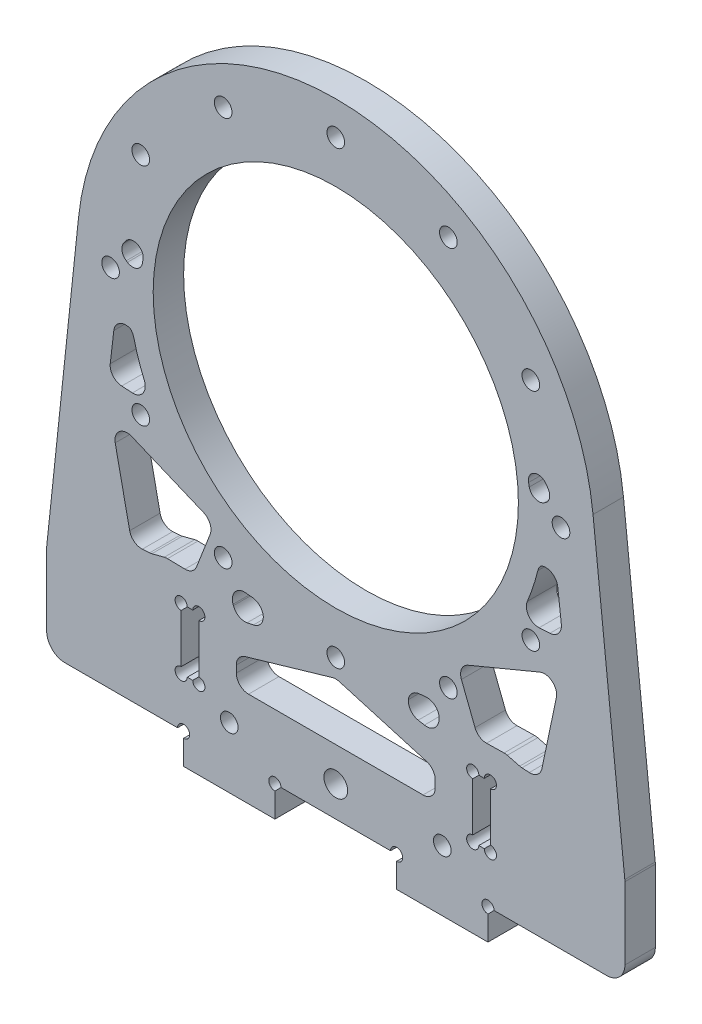
from build123d import *

# Parameters (mm, degrees)
SKETCH_1_R          = 30
SKETCH_1_R_2        = 1.45
EXTRUDE_1_DEPTH     = 5
SKETCH_2_W          = 15
SKETCH_2_H          = 5
EXTRUDE_2_DEPTH     = 5
SKETCH_3_R          = 1
CUT_EXTRUDE_1_DEPTH = 114.081828779
SKETCH_4_R          = 1.95
SKETCH_4_R_2        = 1.45
CUT_EXTRUDE_2_DEPTH = 114.081828779
FILLET_1_R          = 3
SKETCH_5_W          = 2.9
SKETCH_5_H          = 10
CUT_EXTRUDE_3_DEPTH = 114.081828779
SKETCH_6_R          = 1
CUT_EXTRUDE_4_DEPTH = 114.081828779
CUT_EXTRUDE_8_DEPTH = 114.081828779
FILLET_2_R          = 2
FILLET_3_R          = 1.6


with BuildPart() as part:
    # 草图1 → 凸台-拉伸1 (new body)
    with BuildSketch(Plane.XY):
        with BuildLine():
            Line((-42.263952975, 64.473061473), (-47.5, 15))
            Line((-47.5, 15), (-47.5, 0))
            Line((-47.5, 0), (47.5, 0))
            Line((47.5, 0), (47.5, 15))
            Line((47.5, 15), (42.263952975, 64.473061473))
            ThreePointArc((42.263952975, 64.473061473), (0, 102.5), (-42.263952975, 64.473061473))
        make_face()
        with Locations((0, 60)):
            Circle(SKETCH_1_R, mode=Mode.SUBTRACT)
        with Locations((0, 97)):
            Circle(SKETCH_1_R_2, mode=Mode.SUBTRACT)
        with Locations((18.5, 92.04293994)):
            Circle(SKETCH_1_R_2, mode=Mode.SUBTRACT)
        with Locations((32.04293994, 78.5)):
            Circle(SKETCH_1_R_2, mode=Mode.SUBTRACT)
        with Locations((37, 60)):
            Circle(SKETCH_1_R_2, mode=Mode.SUBTRACT)
        with Locations((32.04293994, 41.5)):
            Circle(SKETCH_1_R_2, mode=Mode.SUBTRACT)
        with Locations((18.5, 27.95706006)):
            Circle(SKETCH_1_R_2, mode=Mode.SUBTRACT)
        with Locations((0, 23)):
            Circle(SKETCH_1_R_2, mode=Mode.SUBTRACT)
        with Locations((-18.5, 27.95706006)):
            Circle(SKETCH_1_R_2, mode=Mode.SUBTRACT)
        with Locations((-32.04293994, 41.5)):
            Circle(SKETCH_1_R_2, mode=Mode.SUBTRACT)
        with Locations((-37, 60)):
            Circle(SKETCH_1_R_2, mode=Mode.SUBTRACT)
        with Locations((-32.04293994, 78.5)):
            Circle(SKETCH_1_R_2, mode=Mode.SUBTRACT)
        with Locations((-18.5, 92.04293994)):
            Circle(SKETCH_1_R_2, mode=Mode.SUBTRACT)
    extrude(amount=EXTRUDE_1_DEPTH)

    # 草图2 → 凸台-拉伸2 (add)
    with BuildSketch(Plane.XY.offset(5)):
        with Locations((-17.5, -2.5)):
            Rectangle(SKETCH_2_W, SKETCH_2_H)
        with Locations((17.5, -2.5)):
            Rectangle(SKETCH_2_W, SKETCH_2_H)
    extrude(amount=-EXTRUDE_2_DEPTH)

    # 草图3 → 切除-拉伸1 (cut, through all)
    with BuildSketch(Plane.XY.offset(5)):
        with Locations((-25, 0)):
            Circle(SKETCH_3_R)
        with Locations((-10, 0)):
            Circle(SKETCH_3_R)
        with Locations((10, 0)):
            Circle(SKETCH_3_R)
        with Locations((25, 0)):
            Circle(SKETCH_3_R)
    extrude(amount=-CUT_EXTRUDE_1_DEPTH, mode=Mode.SUBTRACT)

    # 草图4 → 切除-拉伸2 (cut, through all)
    with BuildSketch(Plane.XY.offset(5)):
        with Locations((0, 5)):
            Circle(SKETCH_4_R)
        with Locations((-17.5, 5)):
            Circle(SKETCH_4_R_2)
        with Locations((17.5, 5)):
            Circle(SKETCH_4_R_2)
    extrude(amount=-CUT_EXTRUDE_2_DEPTH, mode=Mode.SUBTRACT)

    # 圆角1
    fillet_1_edges = [part.edges().sort_by_distance(p)[0] for p in [
        (47.5, 15, 2.5),
        (47.5, 0, 2.5),
        (-47.5, 0, 2.5),
        (-47.5, 15, 2.5),
    ]]
    fillet(fillet_1_edges, radius=FILLET_1_R)

    # 草图5 → 切除-拉伸3 (cut, through all)
    with BuildSketch(Plane.XY.offset(5)):
        with Locations((23.95, 13)):
            Rectangle(SKETCH_5_W, SKETCH_5_H)
        with Locations((-23.95, 13)):
            Rectangle(SKETCH_5_W, SKETCH_5_H)
    extrude(amount=-CUT_EXTRUDE_3_DEPTH, mode=Mode.SUBTRACT)

    # 草图6 → 切除-拉伸4 (cut, through all)
    with BuildSketch(Plane.XY.offset(5)):
        with Locations((-25.4, 18)):
            Circle(SKETCH_6_R)
        with Locations((-22.5, 18)):
            Circle(SKETCH_6_R)
        with Locations((-22.5, 8)):
            Circle(SKETCH_6_R)
        with Locations((-25.4, 8)):
            Circle(SKETCH_6_R)
        with Locations((22.5, 8)):
            Circle(SKETCH_6_R)
        with Locations((25.4, 8)):
            Circle(SKETCH_6_R)
        with Locations((25.4, 18)):
            Circle(SKETCH_6_R)
        with Locations((22.5, 18)):
            Circle(SKETCH_6_R)
    extrude(amount=-CUT_EXTRUDE_4_DEPTH, mode=Mode.SUBTRACT)

    # 草图8 → 切除-拉伸8 (cut, through all)
    with BuildSketch(Plane.XY.offset(5)):
        Polygon((0, 20.025146162), (-16.339601949, 15.259410627), (-16.339601949, 10.613477651), (16.339601949, 10.613477651), (16.339601949, 15.259410627), align=None)
        Polygon((-30.109464936, 71.583435684), (-35.782910883, 63.127084449), (-32.249041652, 60.831531558), align=None)
        with BuildLine():
            Line((-33.367864043, 52.721906453), (-36.096347123, 54.465236887))
            Line((-36.096347123, 54.465236887), (-37.30471842, 44.149631262))
            Line((-37.30471842, 44.149631262), (-30.041095919, 43.754460538))
            ThreePointArc((-30.041095919, 43.754460538), (-32.01995975, 48.12114593), (-33.367864043, 52.721906453))
        make_face()
        Polygon((-37.022098899, 39.137590304), (-19.929443434, 32.017276443), (-23.381416743, 23.164401068), (-27.91774405, 23.243912697), (-30.400000513, 22.607692331), (-33.508000895, 22.414649837), align=None)
        Polygon((-17.935646487, 25.106993948), (-12.069057766, 24.527768977), (-11.742060632, 21.195220761), (-16.241933778, 20.349175856), align=None)
        Polygon((35.782910883, 63.127084449), (32.249041652, 60.831531558), (30.109464936, 71.583435684), align=None)
        with BuildLine():
            Line((36.096347123, 54.465236887), (37.30471842, 44.149631262))
            Line((37.30471842, 44.149631262), (30.041095919, 43.754460538))
            ThreePointArc((30.041095919, 43.754460538), (32.01995975, 48.12114593), (33.367864043, 52.721906453))
            Line((33.367864043, 52.721906453), (36.096347123, 54.465236887))
        make_face()
        Polygon((11.742060632, 21.195220761), (16.241933778, 20.349175856), (17.935646487, 25.106993948), (12.069057766, 24.527768977), align=None)
        Polygon((19.929443434, 32.017276443), (23.381416743, 23.164401068), (27.91774405, 23.243912697), (30.400000513, 22.607692331), (33.508000895, 22.414649837), (37.022098899, 39.137590304), align=None)
    extrude(amount=-CUT_EXTRUDE_8_DEPTH, mode=Mode.SUBTRACT)

    # 圆角2
    # the kernel refuses this fillet: 2 mm, written as the material it adds along each edge
    with BuildSketch(Plane(origin=(-37.30471842, 44.149631262, 5), x_dir=(0.11634461196188335, 0.9932089061559198, 0), z_dir=(0, 0, -1)), Plane(origin=(37.30471842, 44.149631262, 5), x_dir=(-0.9985233749387965, -0.05432374895785155, 0), z_dir=(0, 0, -1))) as fillet_2_piece_1:
        with BuildLine():
            CenterArc((FILLET_2_R * 1.06427993577, FILLET_2_R), FILLET_2_R, 176.432868177, 93.567131823)
            Line((FILLET_2_R * 0.0662173512824, FILLET_2_R * 1.06221798331), (0, 0))
            Line((0, 0), (FILLET_2_R * 1.06427993577, 0))
        make_face()
    extrude(amount=5)
    with BuildSketch(Plane(origin=(-36.096347123, 54.465236887, 5), x_dir=(0.8426776356242073, -0.5384184268938014, 0), z_dir=(0, 0, -1)), Plane(origin=(36.096347123, 54.465236887, 5), x_dir=(0.11634461196188507, -0.9932089061559196, 0), z_dir=(0, 0, -1))) as fillet_2_piece_2:
        with BuildLine():
            CenterArc((FILLET_2_R * 1.59707174354, FILLET_2_R), FILLET_2_R, 154.1051472, 115.8948528)
            Line((FILLET_2_R * 0.697474727873, FILLET_2_R * 1.4367209743), (0, 0))
            Line((0, 0), (FILLET_2_R * 1.59707174354, 0))
        make_face()
    extrude(amount=5)
    with BuildSketch(Plane(origin=(-33.367864043, 52.721906453, 5), x_dir=(-0.8426776356242092, 0.5384184268937985, 0), z_dir=(0, 0, -1))) as fillet_2_piece_3:
        with BuildLine():
            CenterArc((0.817077761, -2), FILLET_2_R, 90, 43.787152579)
            ThreePointArc((-0.566884871, -0.556169182), (-0.281825785, -0.279732389), (0, 0))
            Line((0, 0), (0.817077761, 0))
        make_face()
    extrude(amount=5)
    with BuildSketch(Plane(origin=(-30.041095919, 43.754460538, 5), x_dir=(-0.9985233749387965, 0.05432374895785151, 0), z_dir=(0, 0, -1))) as fillet_2_piece_4:
        with BuildLine():
            CenterArc((3.376722126, 2), FILLET_2_R, 153.99059072, 116.00940928)
            ThreePointArc((1.579278039, 2.877037487), (0.824218847, 1.419537009), (0, 0))
            Line((0, 0), (3.376722126, 0))
        make_face()
    extrude(amount=5)
    with BuildSketch(Plane(origin=(30.041095919, 43.754460538, 5), x_dir=(0.9985233749387965, 0.05432374895785151, 0), z_dir=(0, 0, -1))) as fillet_2_piece_5:
        with BuildLine():
            CenterArc((3.376722126, -2), FILLET_2_R, 90, 116.00940928)
            ThreePointArc((1.579278039, -2.877037487), (0.824218847, -1.419537009), (0, 0))
            Line((0, 0), (3.376722126, 0))
        make_face()
    extrude(amount=5)
    with BuildSketch(Plane(origin=(33.367864043, 52.721906453, 5), x_dir=(0.8426776356242092, 0.5384184268937985, 0), z_dir=(0, 0, -1))) as fillet_2_piece_6:
        with BuildLine():
            CenterArc((0.817077761, 2), FILLET_2_R, 226.212847421, 43.787152579)
            ThreePointArc((-0.566884871, 0.556169182), (-0.281825785, 0.279732389), (0, 0))
            Line((0, 0), (0.817077761, 0))
        make_face()
    extrude(amount=5)
    with BuildSketch(Plane(origin=(-30.400000513, 22.607692331, 5), x_dir=(-0.9980766454148148, -0.06199201462696654, 0), z_dir=(0, 0, -1)), Plane(origin=(30.400000513, 22.607692331, 5), x_dir=(-0.9686878644632322, 0.24828173763219638, 0), z_dir=(0, 0, -1))) as fillet_2_piece_7:
        with BuildLine():
            CenterArc((FILLET_2_R * 0.0947188756303, FILLET_2_R), FILLET_2_R, 259.178302192, 10.821697808)
            Line((-FILLET_2_R * 0.0930344159206, FILLET_2_R * 0.0177837806716), (0, 0))
            Line((0, 0), (FILLET_2_R * 0.0947188756303, 0))
        make_face()
    extrude(amount=5)
    with BuildSketch(Plane(origin=(-33.508000895, 22.414649837, 5), x_dir=(-0.20564505093955646, 0.9786266463897594, 0), z_dir=(0, 0, -1)), Plane(origin=(33.508000895, 22.414649837, 5), x_dir=(-0.998076645414815, 0.061992014626963396, 0), z_dir=(0, 0, -1))) as fillet_2_piece_8:
        with BuildLine():
            CenterArc((FILLET_2_R * 0.8645010422, FILLET_2_R), FILLET_2_R, 188.313102586, 81.686897414)
            Line((-FILLET_2_R * 0.124991709148, FILLET_2_R * 0.855417514789), (0, 0))
            Line((0, 0), (FILLET_2_R * 0.8645010422, 0))
        make_face()
    extrude(amount=5)
    with BuildSketch(Plane(origin=(-12.069057766, 24.527768977, 5), x_dir=(0.09765327609951818, -0.9952204970090955, 0), z_dir=(0, 0, -1)), Plane(origin=(12.069057766, 24.527768977, 5), x_dir=(0.995161261104687, 0.09825509857777821, 0), z_dir=(0, 0, -1))) as fillet_2_piece_9:
        with BuildLine():
            CenterArc((FILLET_2_R * 0.820784650913, FILLET_2_R), FILLET_2_R, 191.242751752, 78.757248248)
            Line((-FILLET_2_R * 0.160025301699, FILLET_2_R * 0.805033754566), (0, 0))
            Line((0, 0), (FILLET_2_R * 0.820784650913, 0))
        make_face()
    extrude(amount=5)
    with BuildSketch(Plane(origin=(-11.742060632, 21.195220761, 5), x_dir=(-0.982780338788894, -0.1847777196795835, 0), z_dir=(0, 0, -1))) as fillet_2_piece_10:
        with BuildLine():
            CenterArc((FILLET_2_R * 0.915623091296, FILLET_2_R), FILLET_2_R, 185.044121632, 84.955878368)
            Line((-FILLET_2_R * 0.080504195601, FILLET_2_R * 0.912077145753), (0, 0))
            Line((0, 0), (FILLET_2_R * 0.915623091296, 0))
        make_face()
    extrude(amount=5)
    with BuildSketch(Plane(origin=(-16.339601949, 15.259410627, 5), x_dir=(0.9599997110007774, 0.2800009908525751, 0), z_dir=(0, 0, -1)), Plane(origin=(16.339601949, 15.259410627, 5), x_dir=(0, -1, 0), z_dir=(0, 0, -1))) as fillet_2_piece_11:
        with BuildLine():
            CenterArc((FILLET_2_R * 0.749999193642, FILLET_2_R), FILLET_2_R, 196.260263845, 73.739736155)
            Line((-FILLET_2_R * 0.210000517358, FILLET_2_R * 0.719999009147), (0, 0))
            Line((0, 0), (FILLET_2_R * 0.749999193642, 0))
        make_face()
    extrude(amount=5)
    with BuildSketch(Plane(origin=(0, 20.025146162, 5), x_dir=(-0.959999711000778, -0.2800009908525733, 0), z_dir=(0, 0, -1))) as fillet_2_piece_12:
        with BuildLine():
            CenterArc((FILLET_2_R * 0.291667786609, -FILLET_2_R), FILLET_2_R, 90, 32.520527691)
            Line((-FILLET_2_R * 0.245933953988, -FILLET_2_R * 0.156801109757), (0, 0))
            Line((0, 0), (FILLET_2_R * 0.291667786609, 0))
        make_face()
    extrude(amount=5)
    with BuildSketch(Plane(origin=(16.339601949, 10.613477651, 5), x_dir=(-1, 0, 0), z_dir=(0, 0, -1)), Plane(origin=(-16.339601949, 10.613477651, 5), x_dir=(0, 1, 0), z_dir=(0, 0, -1))) as fillet_2_piece_13:
        with BuildLine():
            CenterArc((FILLET_2_R, FILLET_2_R), FILLET_2_R, 180, 90)
            Line((0, FILLET_2_R), (0, 0))
            Line((0, 0), (FILLET_2_R, 0))
        make_face()
    extrude(amount=5)
    with BuildSketch(Plane(origin=(-37.022098899, 39.137590304, 5), x_dir=(0.2056450509395565, -0.9786266463897595, 0), z_dir=(0, 0, -1))) as fillet_2_piece_14:
        with BuildLine():
            CenterArc((FILLET_2_R * 1.8999824746, -FILLET_2_R), FILLET_2_R, 90, 124.482483163)
            Line((FILLET_2_R * 1.07568315911, -FILLET_2_R * 1.56615425326), (0, 0))
            Line((0, 0), (FILLET_2_R * 1.8999824746, 0))
        make_face()
    extrude(amount=5)
    with BuildSketch(Plane(origin=(-23.381416743, 23.164401068, 5), x_dir=(-0.9998464243047609, 0.017525062196299627, 0), z_dir=(0, 0, -1)), Plane(origin=(23.381416743, 23.164401068, 5), x_dir=(-0.36328607534905105, 0.9316776413854115, 0), z_dir=(0, 0, -1))) as fillet_2_piece_15:
        with BuildLine():
            CenterArc((FILLET_2_R * 0.696339280167, FILLET_2_R), FILLET_2_R, 200.29797935, 69.70202065)
            Line((-FILLET_2_R * 0.241561889242, FILLET_2_R * 0.653097425175), (0, 0))
            Line((0, 0), (FILLET_2_R * 0.696339280167, 0))
        make_face()
    extrude(amount=5)
    with BuildSketch(Plane(origin=(-19.929443434, 32.017276443, 5), x_dir=(-0.3632860753490498, -0.9316776413854121, 0), z_dir=(0, 0, -1))) as fillet_2_piece_16:
        with BuildLine():
            CenterArc((FILLET_2_R * 0.977341116833, FILLET_2_R), FILLET_2_R, 181.313077992, 88.686922008)
            Line((-FILLET_2_R * 0.022396287971, FILLET_2_R * 0.977084471752), (0, 0))
            Line((0, 0), (FILLET_2_R * 0.977341116833, 0))
        make_face()
    extrude(amount=5)
    with BuildSketch(Plane(origin=(-16.241933778, 20.349175856, 5), x_dir=(-0.3353689582387902, 0.9420868653419538, 0), z_dir=(0, 0, -1)), Plane(origin=(16.241933778, 20.349175856, 5), x_dir=(-0.9827803387888939, 0.18477771967958412, 0), z_dir=(0, 0, -1))) as fillet_2_piece_17:
        with BuildLine():
            CenterArc((FILLET_2_R * 0.854883879666, FILLET_2_R), FILLET_2_R, 188.946802409, 81.053197591)
            Line((-FILLET_2_R * 0.132949280378, FILLET_2_R * 0.844482644321), (0, 0))
            Line((0, 0), (FILLET_2_R * 0.854883879666, 0))
        make_face()
    extrude(amount=5)
    with BuildSketch(Plane(origin=(19.929443434, 32.017276443, 5), x_dir=(0.3632860753490498, -0.9316776413854121, 0), z_dir=(0, 0, -1))) as fillet_2_piece_18:
        with BuildLine():
            CenterArc((FILLET_2_R * 0.977341116833, -FILLET_2_R), FILLET_2_R, 90, 88.686922008)
            Line((-FILLET_2_R * 0.022396287971, -FILLET_2_R * 0.977084471752), (0, 0))
            Line((0, 0), (FILLET_2_R * 0.977341116833, 0))
        make_face()
    extrude(amount=5)
    with BuildSketch(Plane(origin=(37.022098899, 39.137590304, 5), x_dir=(-0.2056450509395565, -0.9786266463897595, 0), z_dir=(0, 0, -1))) as fillet_2_piece_19:
        with BuildLine():
            CenterArc((FILLET_2_R * 1.8999824746, FILLET_2_R), FILLET_2_R, 145.517516837, 124.482483163)
            Line((FILLET_2_R * 1.07568315911, FILLET_2_R * 1.56615425326), (0, 0))
            Line((0, 0), (FILLET_2_R * 1.8999824746, 0))
        make_face()
    extrude(amount=5)
    with BuildSketch(Plane(origin=(11.742060632, 21.195220761, 5), x_dir=(0.982780338788894, -0.1847777196795835, 0), z_dir=(0, 0, -1))) as fillet_2_piece_20:
        with BuildLine():
            CenterArc((FILLET_2_R * 0.915623091296, -FILLET_2_R), FILLET_2_R, 90, 84.955878368)
            Line((-FILLET_2_R * 0.080504195601, -FILLET_2_R * 0.912077145753), (0, 0))
            Line((0, 0), (FILLET_2_R * 0.915623091296, 0))
        make_face()
    extrude(amount=5)
    with BuildSketch(Plane(origin=(17.935646487, 25.106993948, 5), x_dir=(-0.33536895823878976, -0.9420868653419538, 0), z_dir=(0, 0, -1))) as fillet_2_piece_21:
        with BuildLine():
            CenterArc((FILLET_2_R * 1.5767719014, FILLET_2_R), FILLET_2_R, 154.766324206, 115.233675794)
            Line((FILLET_2_R * 0.672195258469, FILLET_2_R * 1.42631103324), (0, 0))
            Line((0, 0), (FILLET_2_R * 1.5767719014, 0))
        make_face()
    extrude(amount=5)
    with BuildSketch(Plane(origin=(-17.935646487, 25.106993948, 5), x_dir=(0.33536895823878976, -0.9420868653419538, 0), z_dir=(0, 0, -1))) as fillet_2_piece_22:
        with BuildLine():
            CenterArc((FILLET_2_R * 1.5767719014, -FILLET_2_R), FILLET_2_R, 90, 115.233675794)
            Line((FILLET_2_R * 0.672195258469, -FILLET_2_R * 1.42631103324), (0, 0))
            Line((0, 0), (FILLET_2_R * 1.5767719014, 0))
        make_face()
    extrude(amount=5)
    # the kernel refuses this fillet: 2 mm, written as the material it takes off along each edge
    with BuildSketch(Plane(origin=(-27.91774405, 23.243912697, 5.675138862), x_dir=(-0.968687864463235, -0.24828173763218533, 0), z_dir=(0, 0, -1)), Plane(origin=(27.91774405, 23.243912697, 5.675138862), x_dir=(-0.9998464243047606, -0.017525062196317658, 0), z_dir=(0, 0, -1))) as fillet_2_2_piece_1:
        with BuildLine():
            CenterArc((FILLET_2_R * 0.135027772361, -FILLET_2_R), FILLET_2_R, 90, 15.380021044)
            Line((-FILLET_2_R * 0.130192150304, -FILLET_2_R * 0.0358120553432), (0, 0))
            Line((0, 0), (FILLET_2_R * 0.135027772361, 0))
        make_face()
    extrude(amount=6.350277724, mode=Mode.SUBTRACT)

    # 圆角3
    fillet_3_edges = [part.edges().sort_by_distance(p)[0] for p in [
        (32.249041652, 60.831531558, 2.5),
        (30.109464936, 71.583435684, 2.5),
        (35.782910883, 63.127084449, 2.5),
        (-32.249041652, 60.831531558, 2.5),
        (-35.782910883, 63.127084449, 2.5),
        (-30.109464936, 71.583435684, 2.5),
    ]]
    fillet(fillet_3_edges, radius=FILLET_3_R)


solid = part.part
